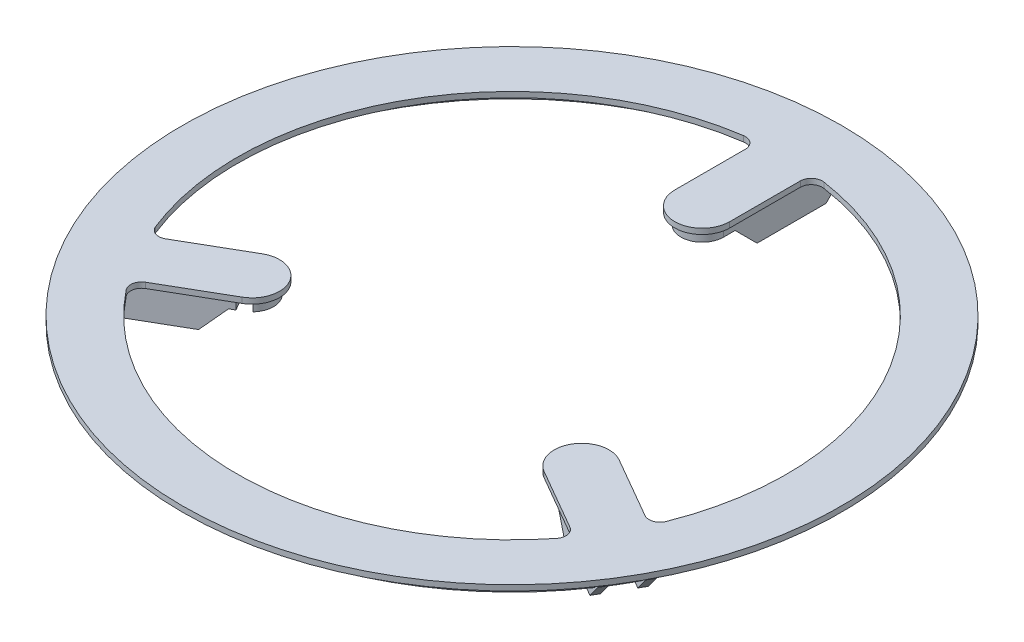
from build123d import *
from build123d.topology import SkipClean

# Parameters (mm, degrees)
SKETCH1_R                    = 150
BOSS_EXTRUDE1_DEPTH          = 2.5
BOSS_EXTRUDE2_DEPTH          = 6
SKETCH3_R                    = 2.9375
BOSS_EXTRUDE3_DEPTH          = 1
BOSS_EXTRUDE4_DEPTH          = 15
CHAMFER1_SIZE                = 10
SKETCH5_R                    = 140
SKETCH5_R_2                  = 135
BOSS_EXTRUDE5_DEPTH          = 7.5
CIRPATTERN1_COUNT            = 3
CHAMFER1_OF_CIRPATTERN1_SIZE = 10
SKETCH6_R                    = 6.263847164
BOSS_EXTRUDE6_DEPTH          = 5
CUT_EXTRUDE2_REACH           = 216.467
SKETCH7_W                    = 5.549678092
SKETCH7_H                    = 5.5
CIRPATTERN2_COUNT            = 3
FILLET1_R                    = 5


with BuildPart() as part:
    # Sketch1 → Boss-Extrude1 (new body)
    with BuildSketch(Plane(origin=(0, 0, 0), x_dir=(1, 0, 0), z_dir=(0, 1, 0))):
        Circle(SKETCH1_R)
        with BuildLine():
            Line((-12.499999821, 86.600423276), (-12.506397258, 124.372786524))
            ThreePointArc((-12.506397258, 124.372786524), (-108.253175473, 62.5), (-113.963191298, -51.355535527))
            Line((-113.963191298, -51.355535527), (-81.248166446, -32.474894246))
            ThreePointArc((-81.248166446, -32.474894246), (-64.174682453, -37.051270189), (-68.748166625, -54.12552903))
            Line((-68.748166625, -54.12552903), (-101.45679404, -73.017250997))
            ThreePointArc((-101.45679404, -73.017250997), (0, -125), (101.45679404, -73.017250997))
            Line((101.45679404, -73.017250997), (68.748166625, -54.12552903))
            ThreePointArc((68.748166625, -54.12552903), (64.174682453, -37.051270189), (81.248166446, -32.474894246))
            Line((81.248166446, -32.474894246), (113.963191298, -51.355535527))
            ThreePointArc((113.963191298, -51.355535527), (108.253175473, 62.5), (12.506397258, 124.372786524))
            Line((12.506397258, 124.372786524), (12.499999821, 86.600423276))
            ThreePointArc((12.499999821, 86.600423276), (0, 74.102540378), (-12.499999821, 86.600423276))
        make_face(mode=Mode.SUBTRACT)
    extrude(amount=BOSS_EXTRUDE1_DEPTH)

    # Sketch2 → Boss-Extrude2 (add)
    with BuildSketch(Plane.XZ):
        with BuildLine():
            Line((-76.041284798, 46.048019581), (-72.100762763, 43.773847901))
            ThreePointArc((-72.100762763, 43.773847901), (-76.468319115, 40.757071843), (-76.041284798, 46.048019581))
        make_face()
        with BuildLine():
            Line((77.89939715, 42.829674582), (73.959645685, 40.554168234))
            ThreePointArc((73.959645685, 40.554168234), (73.530819157, 45.844971017), (77.89939715, 42.829674582))
        make_face()
        with BuildLine():
            Line((-1.858112352, -88.877694162), (-1.858882922, -84.328016136))
            ThreePointArc((-1.858882922, -84.328016136), (2.937499958, -86.602042859), (-1.858112352, -88.877694162))
        make_face()
    extrude(amount=BOSS_EXTRUDE2_DEPTH)

    # Sketch3 → Boss-Extrude3 (add)
    with SkipClean():  # the faces are left unmerged after this step: merging them gives an invalid solid
        with BuildSketch(Plane.XZ):
            with Locations((-75, 43.301270189)):
                Circle(SKETCH3_R)
            with Locations((75, 43.301270189)):
                Circle(SKETCH3_R)
            with Locations((0, -86.602540378)):
                Circle(SKETCH3_R)
        extrude(amount=BOSS_EXTRUDE3_DEPTH)

    # Sketch4 → Boss-Extrude4 (add)
    with SkipClean():  # the faces are left unmerged after this step: merging them gives an invalid solid
        with BuildSketch(Plane.XZ):
            Polygon((-128.89230729, 63.194244449), (-84.389895617, 37.50076509), (-82.639895617, 40.531854003), (-127.14230729, 66.225333363), align=None)
            Polygon((-120.923974711, 76.995801328), (-76.421563038, 51.302321968), (-74.671563038, 54.333410882), (-119.173974711, 80.026890241), align=None)
        boss_extrude4 = extrude(amount=BOSS_EXTRUDE4_DEPTH)

    # Chamfer1
    chamfer1_edges = [part.edges().sort_by_distance(p)[0] for p in [
        (-83.514895617, -15, 39.016309547),
        (-75.546563038, -15, 52.817866425),
        (-120.048974711, -15, 78.511345784),
        (-128.01730729, -15, 64.709788906),
    ]]
    chamfer(chamfer1_edges, length=CHAMFER1_SIZE)

    # Sketch5 → Boss-Extrude5 (add)
    with SkipClean():  # the faces are left unmerged after this step: merging them gives an invalid solid
        with BuildSketch(Plane.XZ):
            Circle(SKETCH5_R)
            Circle(SKETCH5_R_2, mode=Mode.SUBTRACT)
        extrude(amount=BOSS_EXTRUDE5_DEPTH)

    # CirPattern1: Boss-Extrude4 ×3 about axis
    with SkipClean():  # the faces are left unmerged after this step: merging them gives an invalid solid
        cirpattern1_axis = Axis((0, 0, 0), (0, 1, 0))
        for i in range(1, CIRPATTERN1_COUNT):
            add(boss_extrude4.rotate(cirpattern1_axis, i * 360 / CIRPATTERN1_COUNT))

    # Chamfer1 of CirPattern1
    chamfer1_of_cirpattern1_edges = [part.edges().sort_by_distance(p)[0] for p in [
        (75.546563038, -15, 52.817866425),
        (83.514895617, -15, 39.016309547),
        (128.01730729, -15, 64.709788906),
        (120.048974711, -15, 78.511345784),
        (7.968332579, -15, -91.834175972),
        (-7.968332579, -15, -91.834175972),
        (-7.968332579, -15, -143.22113469),
        (7.968332579, -15, -143.22113469),
    ]]
    chamfer(chamfer1_of_cirpattern1_edges, length=CHAMFER1_OF_CIRPATTERN1_SIZE)

    # Sketch6 → Boss-Extrude6 (add)
    with SkipClean():  # the faces are left unmerged after this step: merging them gives an invalid solid
        with BuildSketch(Plane.XZ):
            with BuildLine():
                Line((-74.671563038, 54.333410882), (-70.140833711, 51.717593085))
                ThreePointArc((-70.140833711, 51.717593085), (-66.583677104, 38.4421039), (-79.859166289, 34.884947293))
                Line((-79.859166289, 34.884947293), (-84.389895617, 37.50076509))
                Line((-84.389895617, 37.50076509), (-83.625725577, 38.824346425))
                ThreePointArc((-83.625725577, 38.824346425), (-83.416322896, 48.160436479), (-75.435733078, 53.009829547))
                Line((-75.435733078, 53.009829547), (-74.671563038, 54.333410882))
            make_face()
            with Locations((-75, 43.301270189)):
                Circle(SKETCH6_R, mode=Mode.SUBTRACT)
        boss_extrude6 = extrude(amount=BOSS_EXTRUDE6_DEPTH)

    # Sketch7 → Cut-Extrude2 (cut, up to next)
    with BuildSketch(Plane(origin=(0.936307925, 0, 1.622367408), x_dir=(0.8661100754576421, 0, -0.4998533156744661), z_dir=(0.4998533156744661, 0, 0.8661100754576421)), mode=Mode.PRIVATE) as cut_extrude2_sk1:
        with Locations((-86.602539136, -3.75)):
            Rectangle(SKETCH7_W, SKETCH7_H)
    cut_extrude2_tool1 = extrude(cut_extrude2_sk1.sketch, amount=CUT_EXTRUDE2_REACH, mode=Mode.PRIVATE) & part.part
    cut_extrude2 = cut_extrude2_tool1.solids().sort_by_distance((-74.071024, -3.75, 44.910934))[0]
    add(cut_extrude2, mode=Mode.SUBTRACT)

    # CirPattern2: Boss-Extrude6, Cut-Extrude2 ×3 about axis
    with SkipClean():  # the faces are left unmerged after this step: merging them gives an invalid solid
        cirpattern2_axis = Axis((0, 0, 0), (0, 1, 0))
        add([boss_extrude6.rotate(cirpattern2_axis, i * 360 / CIRPATTERN2_COUNT) for i in range(1, CIRPATTERN2_COUNT)])
        add([cut_extrude2.rotate(cirpattern2_axis, i * 360 / CIRPATTERN2_COUNT) for i in range(1, CIRPATTERN2_COUNT)], mode=Mode.SUBTRACT)

    # Fillet1
    fillet1_edges = [part.edges().sort_by_distance(p)[0] for p in [
        (101.45679404, 1.25, 73.017250997),
        (113.963191298, 1.25, 51.355535527),
        (-113.963191298, 1.25, 51.355535527),
        (-101.45679404, 1.25, 73.017250997),
        (12.506397258, 1.25, -124.372786524),
        (-12.506397258, 1.25, -124.372786524),
    ]]
    fillet(fillet1_edges, radius=FILLET1_R)


solid = part.part
